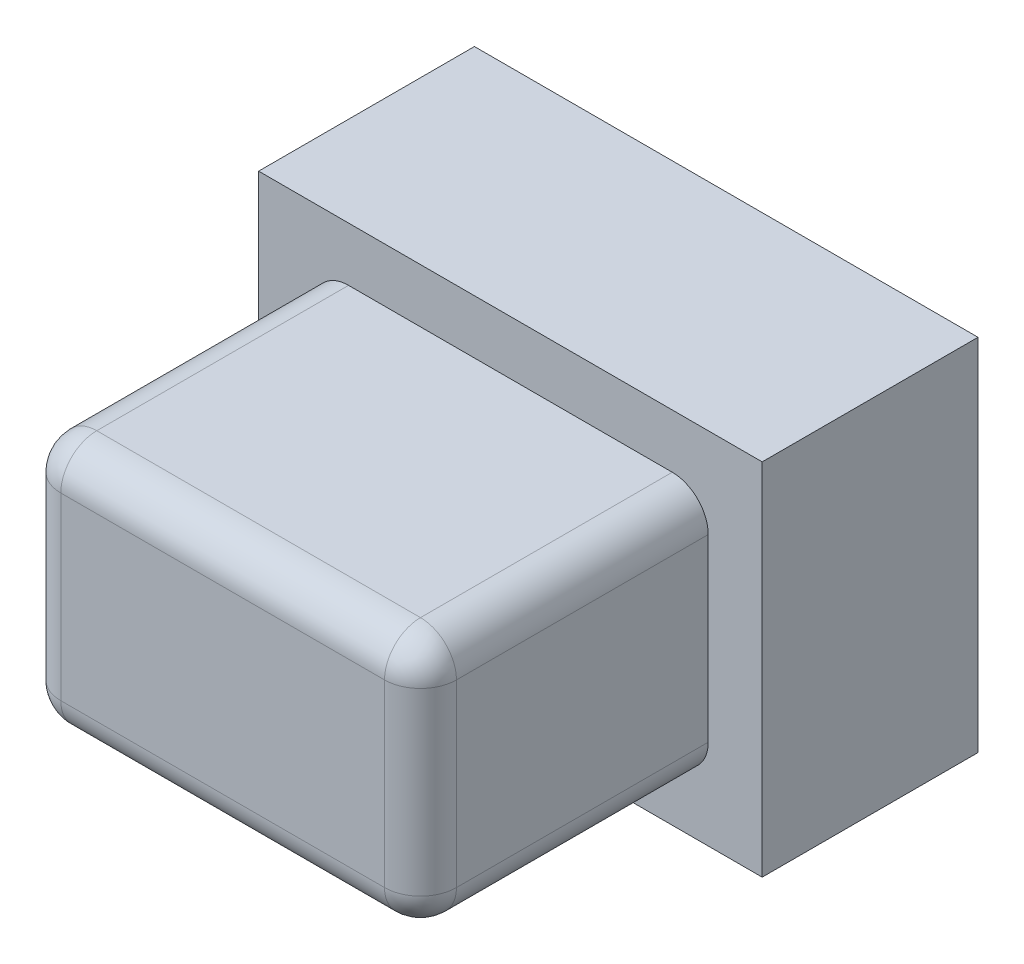
from build123d import *

# Parameters (mm, degrees)
SKETCH_1_W      = 7
SKETCH_1_H      = 5
EXTRUDE_1_DEPTH = 3
SKETCH_2_W      = 5.5
SKETCH_2_H      = 3.5
EXTRUDE_2_DEPTH = 4
FILLET_1_R      = 0.5
FILLET_2_R      = 0.5


with BuildPart() as part:
    # 草图1 → 凸台-拉伸1 (new body)
    with BuildSketch(Plane.XY):
        Rectangle(SKETCH_1_W, SKETCH_1_H)
    extrude(amount=EXTRUDE_1_DEPTH)

    # 草图2 → 凸台-拉伸2 (add)
    with BuildSketch(Plane.XY.offset(3)):
        Rectangle(SKETCH_2_W, SKETCH_2_H)
    extrude(amount=EXTRUDE_2_DEPTH)

    # 圆角1
    fillet_1_edges = [part.edges().sort_by_distance(p)[0] for p in [
        (2.75, 0, 7),
        (0, 1.75, 7),
        (-2.75, 0, 7),
        (0, -1.75, 7),
    ]]
    fillet(fillet_1_edges, radius=FILLET_1_R)

    # 圆角2
    # the kernel refuses this fillet: 0.5 mm, written as the material it takes off along each edge
    with BuildSketch(Plane(origin=(-2.25, 1.25, 6.5), x_dir=(-1, 0, 0), z_dir=(0, 1, 0))) as fillet_2_piece_1_section:
        Polygon((0, 0), (FILLET_2_R, 0), (FILLET_2_R, FILLET_2_R), (0, FILLET_2_R), align=None)
    fillet_2_piece_1 = extrude(amount=FILLET_2_R, mode=Mode.PRIVATE)
    fillet_2_piece_1 = fillet_2_piece_1 - Plane(origin=(-2.25, 1.25, 6.5), x_dir=(0.7071067811865475, 0, -0.7071067811865475), z_dir=(0, 1, 0)) * Sphere(FILLET_2_R, mode=Mode.PRIVATE)
    add(fillet_2_piece_1, mode=Mode.SUBTRACT)
    with BuildSketch(Plane(origin=(2.25, 1.25, 6.5), x_dir=(1, 0, 0), z_dir=(0, 1, 0))) as fillet_2_piece_2_section:
        Polygon((0, 0), (FILLET_2_R, 0), (FILLET_2_R, -FILLET_2_R), (0, -FILLET_2_R), align=None)
    fillet_2_piece_2 = extrude(amount=FILLET_2_R, mode=Mode.PRIVATE)
    fillet_2_piece_2 = fillet_2_piece_2 - Plane(origin=(2.25, 1.25, 6.5), x_dir=(-0.7071067811865475, 0, -0.7071067811865475), z_dir=(0, 1, 0)) * Sphere(FILLET_2_R, mode=Mode.PRIVATE)
    add(fillet_2_piece_2, mode=Mode.SUBTRACT)
    with BuildSketch(Plane(origin=(-2.25, -1.25, 6.5), x_dir=(0, -1, 0), z_dir=(-1, 0, 0))) as fillet_2_piece_3_section:
        Polygon((0, 0), (FILLET_2_R, 0), (FILLET_2_R, FILLET_2_R), (0, FILLET_2_R), align=None)
    fillet_2_piece_3 = extrude(amount=FILLET_2_R, mode=Mode.PRIVATE)
    fillet_2_piece_3 = fillet_2_piece_3 - Plane(origin=(-2.25, -1.25, 6.5), x_dir=(0, 0.7071067811865475, -0.7071067811865475), z_dir=(-1, 0, 0)) * Sphere(FILLET_2_R, mode=Mode.PRIVATE)
    add(fillet_2_piece_3, mode=Mode.SUBTRACT)
    with BuildSketch(Plane(origin=(2.25, -1.25, 6.5), x_dir=(0, -1, 0), z_dir=(1, 0, 0))) as fillet_2_piece_4_section:
        Polygon((0, 0), (FILLET_2_R, 0), (FILLET_2_R, -FILLET_2_R), (0, -FILLET_2_R), align=None)
    fillet_2_piece_4 = extrude(amount=FILLET_2_R, mode=Mode.PRIVATE)
    fillet_2_piece_4 = fillet_2_piece_4 - Plane(origin=(2.25, -1.25, 6.5), x_dir=(0, 0.7071067811865475, -0.7071067811865475), z_dir=(1, 0, 0)) * Sphere(FILLET_2_R, mode=Mode.PRIVATE)
    add(fillet_2_piece_4, mode=Mode.SUBTRACT)
    with BuildSketch(Plane(origin=(2.75, -1.75, 3), x_dir=(0, 1, 0), z_dir=(0, 0, 1)), Plane(origin=(2.75, 1.75, 3), x_dir=(-1, 0, 0), z_dir=(0, 0, 1))) as fillet_2_piece_5:
        with BuildLine():
            CenterArc((FILLET_2_R, FILLET_2_R), FILLET_2_R, 180, 90)
            Line((0, FILLET_2_R), (0, 0))
            Line((0, 0), (FILLET_2_R, 0))
        make_face()
    extrude(amount=3.5, mode=Mode.SUBTRACT)
    with BuildSketch(Plane(origin=(-2.75, -1.75, 3), x_dir=(0, 1, 0), z_dir=(0, 0, 1)), Plane(origin=(-2.75, 1.75, 3), x_dir=(1, 0, 0), z_dir=(0, 0, 1))) as fillet_2_piece_6:
        with BuildLine():
            CenterArc((FILLET_2_R, -FILLET_2_R), FILLET_2_R, 90, 90)
            Line((0, -FILLET_2_R), (0, 0))
            Line((0, 0), (FILLET_2_R, 0))
        make_face()
    extrude(amount=3.5, mode=Mode.SUBTRACT)


solid = part.part
